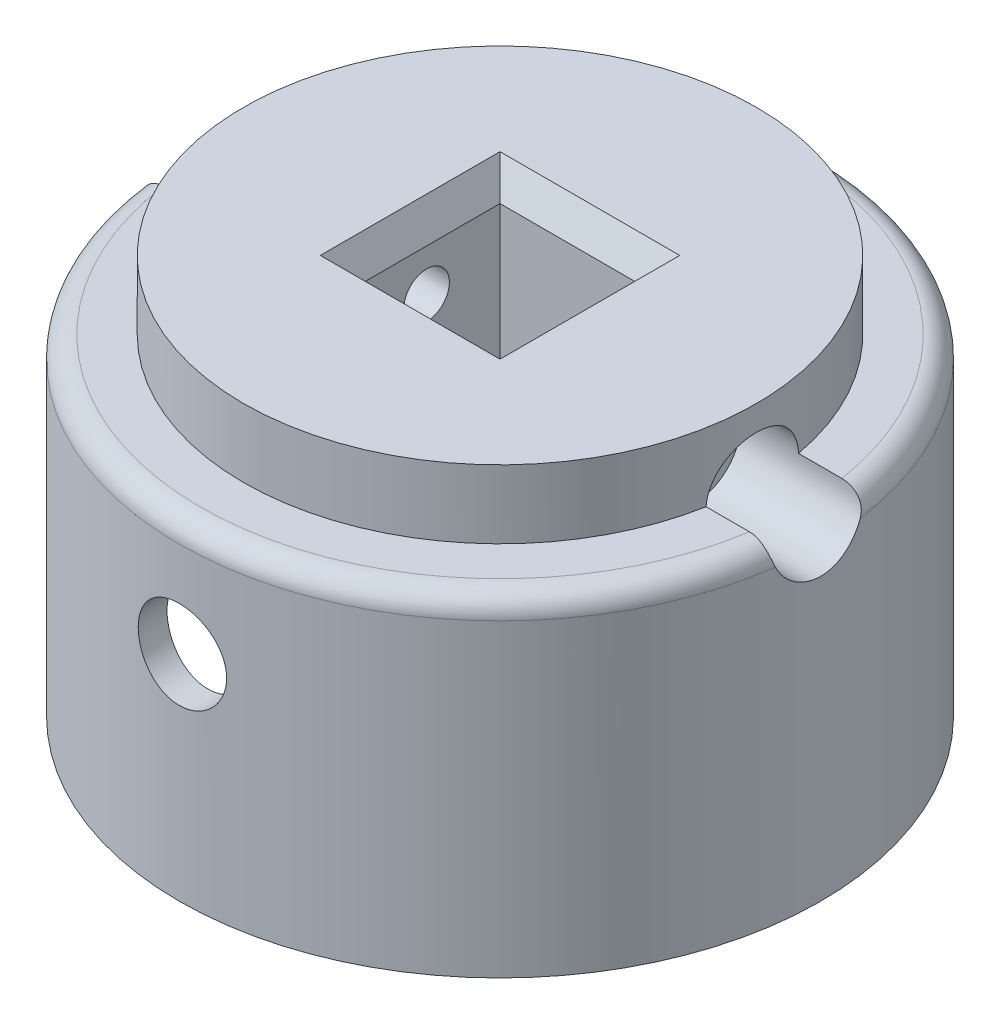
from build123d import *
from OCP.BRepFilletAPI import BRepFilletAPI_MakeChamfer

# Parameters (mm, degrees)
SKETCH1_R                = 22.5
BOSS_EXTRUDE1_DEPTH      = 28
SKETCH2_W                = 10.3
SKETCH2_H                = 10.3
CUT_EXTRUDE2_DEPTH       = 43.385138905
SHELL3_T                 = -2
SKETCH3_R                = 3.1
CUT_EXTRUDE3_DEPTH       = 47.576523056
CHAMFER1_SIZE            = 2
CHAMFER1_SIZE2           = 1.154700538
BOSS_EXTRUDE8_START      = 23
BOSS_EXTRUDE8_DEPTH      = 23
BOSS_EXTRUDE4_DEPTH      = 20
BOSS_EXTRUDE6_DEPTH      = 26
CUT_EXTRUDE5_DEPTH       = 12
CUT_EXTRUDE9_DEPTH       = 2
BOSS_EXTRUDE10_START     = 7
BOSS_EXTRUDE10_DEPTH     = 7
SKETCH21_OUTSIDE_W       = 61.262
SKETCH21_OUTSIDE_H       = 63.966
SKETCH21_OUTSIDE_R       = 18
CUT_EXTRUDE11_DEPTH      = 4.8
CUT_EXTRUDE12_DEPTH      = 47.730672242
CUT_EXTRUDE12_DEPTH_BACK = 47.730672242
SKETCH22_R               = 1.6
CUT_EXTRUDE13_START      = -8.5
SKETCH24_R               = 3.25
CUT_EXTRUDE13_DEPTH      = 39.230672302
CUT_EXTRUDE14_START      = -8.5
CUT_EXTRUDE14_DEPTH      = 39.230672304
FILLET1_R                = 1.5
SKETCH26_R               = 43.919943133
SKETCH26_R_2             = 22.5
CUT_EXTRUDE15_DEPTH      = 44.880328541


with BuildPart() as part:
    # Sketch1 → Boss-Extrude1 (new body)
    with BuildSketch(Plane(origin=(0, 0, 0), x_dir=(1, 0, 0), z_dir=(0, 1, 0))):
        with Locations(Location((0, 0, 0), (0, 0, 270))):
            Circle(SKETCH1_R)
    extrude(amount=BOSS_EXTRUDE1_DEPTH)

    # Sketch2 → Cut-Extrude2 (cut, through all)
    with BuildSketch(Plane.XZ):
        Rectangle(SKETCH2_W, SKETCH2_H)
    extrude(amount=-CUT_EXTRUDE2_DEPTH, mode=Mode.SUBTRACT)

    # Shell3
    shell3_openings = [part.faces().sort_by_distance(p)[0] for p in [
        (0, 0, -21.863603897),
    ]]
    offset(amount=SHELL3_T, openings=shell3_openings, kind=Kind.INTERSECTION)

    # Sketch3 → Cut-Extrude3 (cut, through all)
    with BuildSketch(Plane.XY.offset(7.15)):
        with Locations(Location((0, 15, 0), (0, 0, 270.000000016))):
            Circle(SKETCH3_R)
    extrude(amount=CUT_EXTRUDE3_DEPTH, mode=Mode.SUBTRACT)

    # Chamfer1: one chamfer whose edges measure the first distance from different faces: ONE call of the kernel's chamfer builder (chamfer() names one face for all edges)
    chamfer1_edges_1 = [part.edges().sort_by_distance(p)[0] for p in [
        (5.15, 28, 0),
    ]]
    chamfer1_side_1 = [part.faces().sort_by_distance(p)[0] for p in [
        (5.15, 14, 0),
    ]]
    chamfer1_edges_2 = [part.edges().sort_by_distance(p)[0] for p in [
        (0, 28, -5.15),
    ]]
    chamfer1_side_2 = [part.faces().sort_by_distance(p)[0] for p in [
        (0, 14, -5.15),
    ]]
    chamfer1_edges_3 = [part.edges().sort_by_distance(p)[0] for p in [
        (-5.15, 28, 0),
    ]]
    chamfer1_side_3 = [part.faces().sort_by_distance(p)[0] for p in [
        (-5.15, 14, 0),
    ]]
    chamfer1_edges_4 = [part.edges().sort_by_distance(p)[0] for p in [
        (0, 28, 5.15),
    ]]
    chamfer1_side_4 = [part.faces().sort_by_distance(p)[0] for p in [
        (0, 14, 5.15),
    ]]
    chamfer1 = BRepFilletAPI_MakeChamfer(part.part.solid().wrapped)
    for e in chamfer1_edges_1:
        chamfer1.Add(CHAMFER1_SIZE, CHAMFER1_SIZE2, e.wrapped, chamfer1_side_1[0].wrapped)  # the first distance lies on this face
    for e in chamfer1_edges_2:
        chamfer1.Add(CHAMFER1_SIZE, CHAMFER1_SIZE2, e.wrapped, chamfer1_side_2[0].wrapped)  # the first distance lies on this face
    for e in chamfer1_edges_3:
        chamfer1.Add(CHAMFER1_SIZE, CHAMFER1_SIZE2, e.wrapped, chamfer1_side_3[0].wrapped)  # the first distance lies on this face
    for e in chamfer1_edges_4:
        chamfer1.Add(CHAMFER1_SIZE, CHAMFER1_SIZE2, e.wrapped, chamfer1_side_4[0].wrapped)  # the first distance lies on this face
    add(Compound.cast(chamfer1.Shape()), mode=Mode.REPLACE)

    # Sketch18 → Boss-Extrude8 (add)
    with BuildSketch(Plane.XZ.offset(-26).offset(BOSS_EXTRUDE8_START)):
        with BuildLine():
            Line((-15.72889581, -7.671495069), (-18.425277949, -8.986608509))
            ThreePointArc((-18.425277949, -8.986608509), (-20.471905462, 1.072887103), (-17.384985971, 10.863344917))
            Line((-17.384985971, 10.863344917), (-14.840841683, 9.273587124))
            ThreePointArc((-14.840841683, 9.273587124), (-17.476016858, 0.915879234), (-15.72889581, -7.671495069))
        make_face()
    extrude(amount=-BOSS_EXTRUDE8_DEPTH)

    # Sketch9 → Boss-Extrude4 (add)
    with BuildSketch(Plane.XZ):
        Polygon((2.057061598, -22.405769292), (-16.596699733, -15.192088664), (-17.678751827, -17.990152864), (0.975009504, -25.203833492), align=None)
    extrude(amount=-BOSS_EXTRUDE4_DEPTH)

    # Sketch11 → Boss-Extrude6 (add)
    with BuildSketch(Plane.XZ):
        with BuildLine():
            Line((2.057061598, -22.405769292), (7.15, -7.15))
            Line((7.15, -7.15), (-7.15, -7.15))
            Line((-7.15, -7.15), (-16.596699733, -15.192088664))
            ThreePointArc((-16.596699733, -15.192088664), (-8.115390707, -20.985481497), (2.057061598, -22.405769292))
        make_face()
    extrude(amount=-BOSS_EXTRUDE6_DEPTH)

    # Sketch12 → Cut-Extrude5 (cut)
    with BuildSketch(Plane.XZ):
        with BuildLine():
            Line((3.835926277, -17.077224747), (2.755377072, -20.3139828))
            ThreePointArc((2.755377072, -20.3139828), (-6.94485615, -19.287793369), (-15.072724539, -13.894710323))
            Line((-15.072724539, -13.894710323), (-12.788386178, -11.950025708))
            ThreePointArc((-12.788386178, -11.950025708), (-5.15835992, -16.725347781), (3.835926277, -17.077224747))
        make_face()
    extrude(amount=-CUT_EXTRUDE5_DEPTH, mode=Mode.SUBTRACT)

    # Sketch17 → Cut-Extrude9 (cut)
    with BuildSketch(Plane.XZ):
        with BuildLine():
            Line((7.15, 7.15), (7.15, -7.15))
            Line((7.15, -7.15), (3.835926277, -17.077224747))
            ThreePointArc((3.835926277, -17.077224747), (-5.15835992, -16.725347781), (-12.788386178, -11.950025708))
            Line((-12.788386178, -11.950025708), (-7.15, -7.15))
            Line((-7.15, -7.15), (-7.15, 7.15))
            Line((-7.15, 7.15), (7.15, 7.15))
        make_face()
    extrude(amount=-CUT_EXTRUDE9_DEPTH, mode=Mode.SUBTRACT)

    # Sketch20 → Boss-Extrude10 (add)
    with BuildSketch(Plane.XZ.offset(-26).offset(BOSS_EXTRUDE10_START)):
        with BuildLine():
            Line((2.755377072, -20.3139828), (7.15, -7.15))
            Line((7.15, -7.15), (7.15, 7.15))
            Line((7.15, 7.15), (-7.15, 7.15))
            Line((-7.15, 7.15), (-7.15, -7.15))
            Line((-7.15, -7.15), (-15.072724539, -13.894710323))
            ThreePointArc((-15.072724539, -13.894710323), (6.94485615, 19.287793369), (2.755377072, -20.3139828))
        make_face()
    extrude(amount=-BOSS_EXTRUDE10_DEPTH)

    # Sketch21 outside → Cut-Extrude11 (cut)
    with BuildSketch(Plane(origin=(0, 28, 0), x_dir=(1, 0, 0), z_dir=(0, 1, 0))):
        with Locations((0, 1.352)):
            Rectangle(SKETCH21_OUTSIDE_W, SKETCH21_OUTSIDE_H)
        with Locations(Location((0, 0, 0), (0, 0, 270))):
            Circle(SKETCH21_OUTSIDE_R, mode=Mode.SUBTRACT)
    extrude(amount=-CUT_EXTRUDE11_DEPTH, mode=Mode.SUBTRACT)

    # Sketch22 → Cut-Extrude12 (cut, two sides: drawn at the far end of the back side and taken through both)
    with BuildSketch(Plane.ZY.offset(-5.15).offset(-CUT_EXTRUDE12_DEPTH_BACK)):
        with Locations((0, 23)):
            Circle(SKETCH22_R)
    extrude(amount=CUT_EXTRUDE12_DEPTH + CUT_EXTRUDE12_DEPTH_BACK, mode=Mode.SUBTRACT)

    # Sketch24 → Cut-Extrude13 (cut, through all)
    with BuildSketch(Plane.ZY.offset(-5.15).offset(CUT_EXTRUDE13_START)):
        with Locations((0, 23)):
            Circle(SKETCH24_R)
    extrude(amount=-CUT_EXTRUDE13_DEPTH, mode=Mode.SUBTRACT)

    # Sketch25 → Cut-Extrude14 (cut, through all)
    with BuildSketch(Plane(origin=(-5.15, 0, 0), x_dir=(0, 0, -1), z_dir=(1, 0, 0)).offset(CUT_EXTRUDE14_START)):
        Polygon((0, 19.75), (2.814582562, 21.375), (2.814582562, 24.625), (0, 26.25), (-2.814582562, 24.625), (-2.814582562, 21.375), align=None)
    extrude(amount=-CUT_EXTRUDE14_DEPTH, mode=Mode.SUBTRACT)

    # Fillet1
    # the kernel refuses this fillet: 1.5 mm, written as the material it takes off along each edge
    with BuildSketch(Plane(origin=(0, 23.2, 0), x_dir=(0, 0, 1), z_dir=(1, 0, 0))) as fillet1_piece_1:
        with BuildLine():
            CenterArc((22.5 - FILLET1_R, FILLET1_R), FILLET1_R, 270, 90)
            Line((22.5, FILLET1_R), (22.5, 0))
            Line((22.5, 0), (22.5 - FILLET1_R, 0))
        make_face()
    revolve(axis=Axis((0, 23.2, 0), (0, -1, 0)), revolution_arc=92.366443414, mode=Mode.SUBTRACT)
    with BuildSketch(Plane(origin=(0, 23.2, 0), x_dir=(-0.9991402664664062, 0, 0.041457543649361384), z_dir=(0.041457543649361384, 0, 0.9991402664664062))) as fillet1_piece_2:
        with BuildLine():
            CenterArc((22.5 - FILLET1_R, FILLET1_R), FILLET1_R, 270, 90)
            Line((22.5, FILLET1_R), (22.5, 0))
            Line((22.5, 0), (22.5 - FILLET1_R, 0))
        make_face()
    revolve(axis=Axis((0, 23.2, 0), (0, -1, 0)), revolution_arc=183.648889302, mode=Mode.SUBTRACT)
    with BuildSketch(Plane(origin=(0, 23.2, 0), x_dir=(0.9997569746526436, 0, -0.022045217925738058), z_dir=(-0.022045217925738058, 0, -0.9997569746526436))) as fillet1_piece_3:
        with BuildLine():
            CenterArc((22.5 - FILLET1_R, FILLET1_R), FILLET1_R, 270, 90)
            Line((22.5, FILLET1_R), (22.5, 0))
            Line((22.5, 0), (22.5 - FILLET1_R, 0))
        make_face()
    revolve(axis=Axis((0, 23.2, 0), (0, -1, 0)), revolution_arc=91.263200277, mode=Mode.SUBTRACT)

    # Sketch26 → Cut-Extrude15 (cut, through all)
    with BuildSketch(Plane.XZ):
        Circle(SKETCH26_R)
        with Locations(Location((0, 0, 0), (0, 0, 352.392535773))):
            Circle(SKETCH26_R_2, mode=Mode.SUBTRACT)
    extrude(amount=-CUT_EXTRUDE15_DEPTH, mode=Mode.SUBTRACT)


solid = part.part
